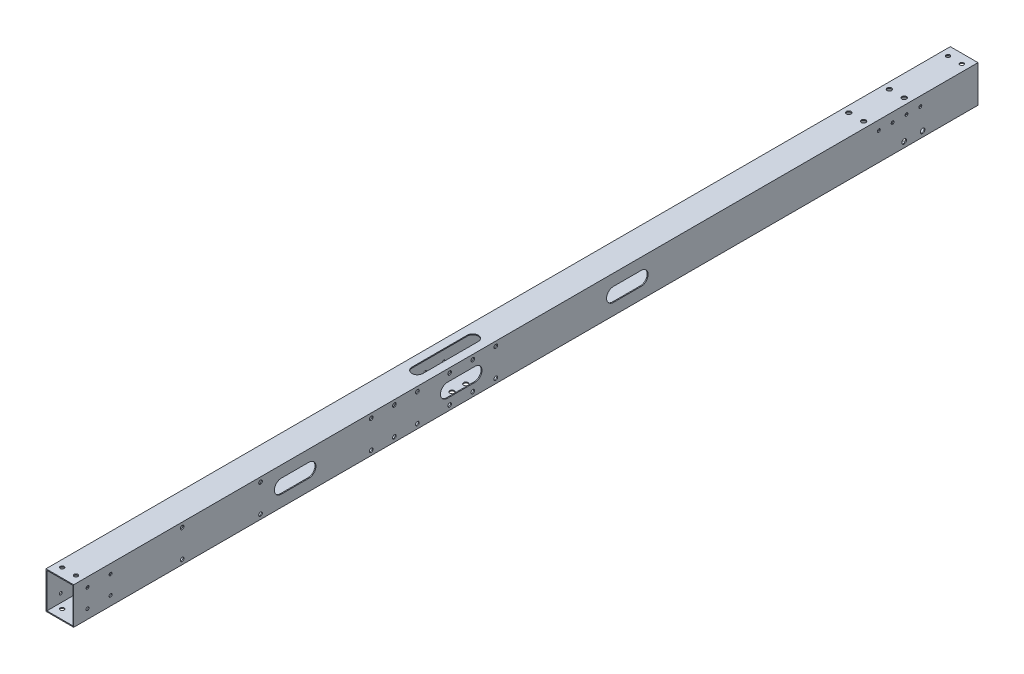
from build123d import *

# Parameters (mm, degrees)
SKETCH_1_W             = 30
SKETCH_1_H             = 40
SKETCH_1_W_2           = 28
SKETCH_1_H_2           = 38
EXTRUDE_1_DEPTH        = 940
SKETCH_5_R             = 2.5
CUT_EXTRUDE_3_DEPTH    = 941.97024395
CUT_EXTRUDE_4_DEPTH    = 1
SKETCH_7_R             = 1.5
CUT_EXTRUDE_5_DEPTH    = 1
SKETCH_17_W            = 30
SKETCH_17_H            = 40
SKETCH_17_W_2          = 28
SKETCH_17_H_2          = 38
EXTRUDE_2_DEPTH        = 20
SKETCH_18_W            = 30
SKETCH_18_H            = 40
SKETCH_18_W_2          = 28
SKETCH_18_H_2          = 38
EXTRUDE_3_DEPTH        = 20
SKETCH_19_R            = 2.1
CUT_EXTRUDE_16_DEPTH   = 961.950050731
SKETCH_20_R            = 1.6
CUT_EXTRUDE_17_DEPTH   = 961.67684473
SKETCH_21_R            = 2.5
SKETCH_21_R_2          = 1.6
CUT_EXTRUDE_18_DEPTH   = 961.67684473
SKETCH_23_R            = 2.5
CUT_EXTRUDE_19_DEPTH   = 961.950050731
SKETCH_24_R            = 4.5
CUT_EXTRUDE_20_DEPTH   = 10
SKETCH_26_R            = 2
CUT_EXTRUDE_22_DEPTH   = 961.67684473
CUT_EXTRUDE_28_DEPTH   = 10
PATTERN_LINEAR_4_COUNT = 2
PATTERN_LINEAR_4_PITCH = 255
PATTERN_LINEAR_8_COUNT = 2
PATTERN_LINEAR_8_PITCH = 205
PATTERN_LINEAR_9_COUNT = 2
PATTERN_LINEAR_9_PITCH = 230
CUT_EXTRUDE_START      = -20
SKETCH_34_R            = 1.75
CUT_EXTRUDE_29_DEPTH   = 20


with BuildPart() as part:
    # 草图1 → 凸台-拉伸1 (new body)
    with BuildSketch(Plane.XY):
        Rectangle(SKETCH_1_W, SKETCH_1_H)
        Rectangle(SKETCH_1_W_2, SKETCH_1_H_2, mode=Mode.SUBTRACT)
    extrude(amount=EXTRUDE_1_DEPTH)

    # 草图5 → 切除-拉伸3 (cut, through all)
    with BuildSketch(Plane.XZ.offset(20)):
        with Locations((-8, 53)):
            Circle(SKETCH_5_R)
        with Locations((8, 53)):
            Circle(SKETCH_5_R)
        with Locations((-8, 97)):
            Circle(SKETCH_5_R)
        with Locations((8, 97)):
            Circle(SKETCH_5_R)
    extrude(amount=-CUT_EXTRUDE_3_DEPTH, mode=Mode.SUBTRACT)

    # 草图6 → 切除-拉伸4 (cut)
    with BuildSketch(Plane(origin=(15, 0, 0), x_dir=(0, 0, -1), z_dir=(1, 0, 0))):
        with BuildLine():
            Line((-345, -7.5), (-375, -7.5))
            ThreePointArc((-375, -7.5), (-382.5, 0), (-375, 7.5))
            Line((-375, 7.5), (-345, 7.5))
            ThreePointArc((-345, 7.5), (-337.5, 0), (-345, -7.5))
        make_face()
        with BuildLine():
            Line((-525, -7.5), (-555, -7.5))
            ThreePointArc((-555, -7.5), (-562.5, 0), (-555, 7.5))
            Line((-555, 7.5), (-525, 7.5))
            ThreePointArc((-525, 7.5), (-517.5, 0), (-525, -7.5))
        make_face()
        with BuildLine():
            Line((-705, -7.5), (-735, -7.5))
            ThreePointArc((-735, -7.5), (-742.5, 0), (-735, 7.5))
            Line((-735, 7.5), (-705, 7.5))
            ThreePointArc((-705, 7.5), (-697.5, 0), (-705, -7.5))
        make_face()
    extrude(amount=-CUT_EXTRUDE_4_DEPTH, mode=Mode.SUBTRACT)

    # 草图7 → 切除-拉伸5 (cut)
    with BuildSketch(Plane.ZY.offset(15)):
        with Locations((350, 0)):
            Circle(SKETCH_7_R)
        with Locations((370, 0)):
            Circle(SKETCH_7_R)
        with Locations((530, 0)):
            Circle(SKETCH_7_R)
        with Locations((550, 0)):
            Circle(SKETCH_7_R)
        with Locations((710, 0)):
            Circle(SKETCH_7_R)
        with Locations((730, 0)):
            Circle(SKETCH_7_R)
    extrude(amount=-CUT_EXTRUDE_5_DEPTH, mode=Mode.SUBTRACT)

    # 草图17 → 凸台-拉伸2 (add)
    with BuildSketch(Plane.XY.offset(940)):
        Rectangle(SKETCH_17_W, SKETCH_17_H)
        Rectangle(SKETCH_17_W_2, SKETCH_17_H_2, mode=Mode.SUBTRACT)
    extrude(amount=EXTRUDE_2_DEPTH)

    # 草图18 → 凸台-拉伸3 (add)
    with BuildSketch(Plane(origin=(0, 0, 0), x_dir=(-1, 0, 0), z_dir=(0, 0, -1))):
        Rectangle(SKETCH_18_W, SKETCH_18_H)
        Rectangle(SKETCH_18_W_2, SKETCH_18_H_2, mode=Mode.SUBTRACT)
    extrude(amount=EXTRUDE_3_DEPTH)

    # 草图19 → 切除-拉伸16 (cut, through all)
    with BuildSketch(Plane(origin=(0, 20, 0), x_dir=(1, 0, 0), z_dir=(0, 1, 0))):
        with Locations((-7.5, -950)):
            Circle(SKETCH_19_R)
        with Locations((7.5, -950)):
            Circle(SKETCH_19_R)
        with Locations((-7.5, 10)):
            Circle(SKETCH_19_R)
        with Locations((7.5, 10)):
            Circle(SKETCH_19_R)
    extrude(amount=-CUT_EXTRUDE_16_DEPTH, mode=Mode.SUBTRACT)

    # 草图20 → 切除-拉伸17 (cut, through all)
    with BuildSketch(Plane(origin=(15, 0, 0), x_dir=(0, 0, -1), z_dir=(1, 0, 0))):
        with Locations((-945, 10)):
            Circle(SKETCH_20_R)
        with Locations((-920, 10)):
            Circle(SKETCH_20_R)
        with Locations((-920, -10)):
            Circle(SKETCH_20_R)
        with Locations((-945, -10)):
            Circle(SKETCH_20_R)
    extrude(amount=-CUT_EXTRUDE_17_DEPTH, mode=Mode.SUBTRACT)

    # 草图21 → 切除-拉伸18 (cut, through all)
    with BuildSketch(Plane(origin=(15, 0, 0), x_dir=(0, 0, -1), z_dir=(1, 0, 0))):
        with Locations((-40, -14)):
            Circle(SKETCH_21_R)
        with Locations((-60, -14)):
            Circle(SKETCH_21_R)
        with Locations((-42.5, 10)):
            Circle(SKETCH_21_R_2)
        with Locations((-57.5, 10)):
            Circle(SKETCH_21_R_2)
        with Locations((-72.5, 10)):
            Circle(SKETCH_21_R_2)
        with Locations((-87.5, 10)):
            Circle(SKETCH_21_R_2)
    extrude(amount=-CUT_EXTRUDE_18_DEPTH, mode=Mode.SUBTRACT)

    # 草图23 → 切除-拉伸19 (cut, through all)
    with BuildSketch(Plane(origin=(0, 20, 0), x_dir=(1, 0, 0), z_dir=(0, 1, 0))):
        with Locations((0, -520)):
            Circle(SKETCH_23_R)
        with Locations((0, -535)):
            Circle(SKETCH_23_R)
        with Locations((0, -550)):
            Circle(SKETCH_23_R)
        with Locations((0, -565)):
            Circle(SKETCH_23_R)
    extrude(amount=-CUT_EXTRUDE_19_DEPTH, mode=Mode.SUBTRACT)

    # 草图24 → 切除-拉伸20 (cut)
    with BuildSketch(Plane(origin=(0, 20, 0), x_dir=(1, 0, 0), z_dir=(0, 1, 0))):
        with Locations((0, -520)):
            Circle(SKETCH_24_R)
        with Locations((0, -535)):
            Circle(SKETCH_24_R)
        with Locations((0, -550)):
            Circle(SKETCH_24_R)
        with Locations((0, -565)):
            Circle(SKETCH_24_R)
    extrude(amount=-CUT_EXTRUDE_20_DEPTH, mode=Mode.SUBTRACT)

    # 草图26 → 切除-拉伸22 (cut, through all)
    with BuildSketch(Plane(origin=(15, 0, 0), x_dir=(0, 0, -1), z_dir=(1, 0, 0))):
        with Locations((-842.5, 15)):
            Circle(SKETCH_26_R)
        with Locations((-842.5, -15)):
            Circle(SKETCH_26_R)
        with Locations((-757.5, -15)):
            Circle(SKETCH_26_R)
        with Locations((-757.5, 15)):
            Circle(SKETCH_26_R)
    cut_extrude_22 = extrude(amount=-CUT_EXTRUDE_22_DEPTH, mode=Mode.SUBTRACT)

    # 草图33 → 切除-拉伸28 (cut)
    with BuildSketch(Plane(origin=(0, 20, 0), x_dir=(1, 0, 0), z_dir=(0, 1, 0))):
        with BuildLine():
            Line((6, -512.5), (6, -572.5))
            ThreePointArc((6, -572.5), (0, -578.5), (-6, -572.5))
            Line((-6, -572.5), (-6, -512.5))
            ThreePointArc((-6, -512.5), (0, -506.5), (6, -512.5))
        make_face()
    extrude(amount=-CUT_EXTRUDE_28_DEPTH, mode=Mode.SUBTRACT)

    # 阵列(线性)4: 切除-拉伸22 ×2
    with Locations(*[(0, 0, -i * PATTERN_LINEAR_4_PITCH) for i in range(1, PATTERN_LINEAR_4_COUNT)]):
        add(cut_extrude_22, mode=Mode.SUBTRACT)

    # 阵列(线性)8: 切除-拉伸22 ×2
    with Locations(*[(0, 0, -i * PATTERN_LINEAR_8_PITCH) for i in range(1, PATTERN_LINEAR_8_COUNT)]):
        add(cut_extrude_22, mode=Mode.SUBTRACT)

    # 阵列(线性)9: 切除-拉伸22 ×2
    with Locations(*[(0, 0, -i * PATTERN_LINEAR_9_PITCH) for i in range(1, PATTERN_LINEAR_9_COUNT)]):
        add(cut_extrude_22, mode=Mode.SUBTRACT)

    # 草图34 → 切除-拉伸29 (cut)
    with BuildSketch(Plane(origin=(15, 0, 0), x_dir=(0, 0, -1), z_dir=(1, 0, 0)).offset(CUT_EXTRUDE_START)):
        with Locations((-935, 0)):
            Circle(SKETCH_34_R)
        with Locations((-915, 0)):
            Circle(SKETCH_34_R)
    extrude(amount=-CUT_EXTRUDE_29_DEPTH, mode=Mode.SUBTRACT)


solid = part.part
